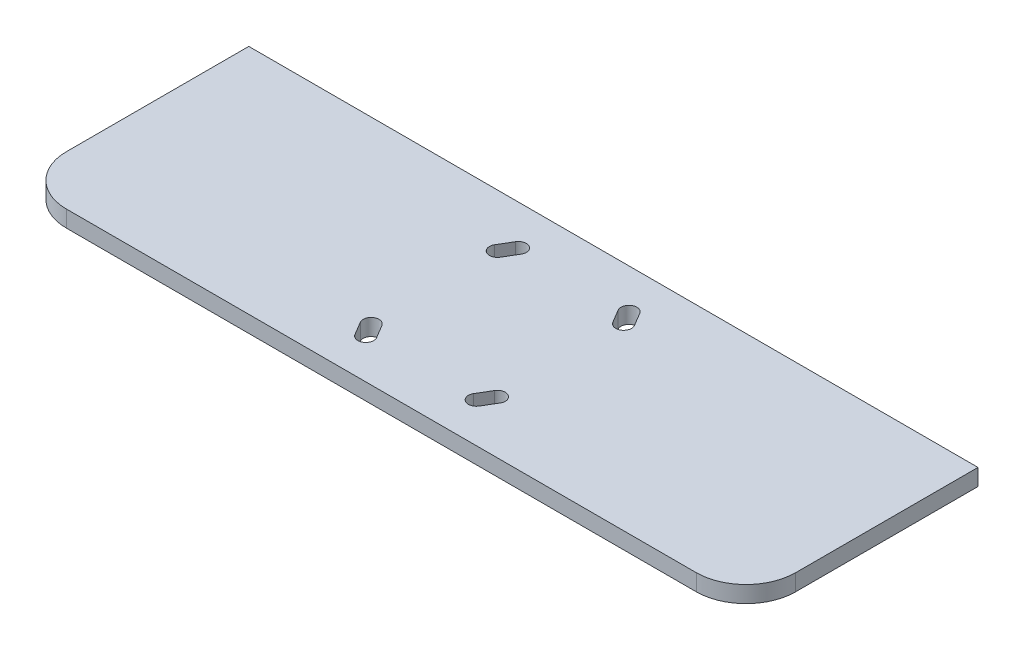
from build123d import *

# Parameters (mm, degrees)
BOSS_EXTRUDE1_DEPTH = 10
CUT_EXTRUDE2_DEPTH  = 232.084400166


with BuildPart() as part:
    # Sketch1 → Boss-Extrude1 (new body)
    with BuildSketch(Plane(origin=(0, 0, 0), x_dir=(1, 0, 0), z_dir=(0, 1, 0))):
        with BuildLine():
            Line((-190, -70), (190, -70))
            ThreePointArc((190, -70), (211.213203436, -61.213203436), (220, -40))
            Line((220, -40), (220, 70))
            Line((220, 70), (-220, 70))
            Line((-220, 70), (-220, -40))
            ThreePointArc((-220, -40), (-211.213203436, -61.213203436), (-190, -70))
        make_face()
    extrude(amount=BOSS_EXTRUDE1_DEPTH)

    # Sketch3 → Cut-Extrude2 (cut, through all)
    with BuildSketch(Plane(origin=(0, 10, 0), x_dir=(1, 0, 0), z_dir=(0, 1, 0))):
        with BuildLine():
            Line((-2466.524123707, -5837.229065469), (-2474.461623707, -5841.991565469))
            ThreePointArc((-2474.461623707, -5841.991565469), (-2480.995719801, -5840.358041446), (-2479.362195777, -5833.823945352))
            Line((-2479.362195777, -5833.823945352), (-2471.424695777, -5829.061445352))
            ThreePointArc((-2471.424695777, -5829.061445352), (-2464.890599684, -5830.694969376), (-2466.524123707, -5837.229065469))
        make_face()
        with BuildLine():
            Line((-2466.524123707, -5905.261445352), (-2474.461623707, -5900.498945352))
            ThreePointArc((-2474.461623707, -5900.498945352), (-2480.995719801, -5902.132469376), (-2479.362195777, -5908.666565469))
            Line((-2479.362195777, -5908.666565469), (-2471.424695777, -5913.429065469))
            ThreePointArc((-2471.424695777, -5913.429065469), (-2464.890599684, -5911.795541446), (-2466.524123707, -5905.261445352))
        make_face()
        with BuildLine():
            Line((-2395.224695777, -5837.229065469), (-2387.287195777, -5841.991565469))
            ThreePointArc((-2387.287195777, -5841.991565469), (-2380.753099684, -5840.358041446), (-2382.386623707, -5833.823945352))
            Line((-2382.386623707, -5833.823945352), (-2390.324123707, -5829.061445352))
            ThreePointArc((-2390.324123707, -5829.061445352), (-2396.858219801, -5830.694969376), (-2395.224695777, -5837.229065469))
        make_face()
        with BuildLine():
            Line((-2395.224695777, -5905.261445352), (-2387.287195777, -5900.498945352))
            ThreePointArc((-2387.287195777, -5900.498945352), (-2380.753099684, -5902.132469376), (-2382.386623707, -5908.666565469))
            Line((-2382.386623707, -5908.666565469), (-2390.324123707, -5913.429065469))
            ThreePointArc((-2390.324123707, -5913.429065469), (-2396.858219801, -5911.795541446), (-2395.224695777, -5905.261445352))
        make_face()
        with BuildLine():
            Line((-34.016189941, -35.649713965), (-29.253689941, -43.587213965))
            ThreePointArc((-29.253689941, -43.587213965), (-30.887213965, -50.121310059), (-37.421310059, -48.487786035))
            Line((-37.421310059, -48.487786035), (-42.183810059, -40.550286035))
            ThreePointArc((-42.183810059, -40.550286035), (-40.550286035, -34.016189941), (-34.016189941, -35.649713965))
        make_face()
        with BuildLine():
            Line((34.016189941, -35.649713965), (29.253689941, -43.587213965))
            ThreePointArc((29.253689941, -43.587213965), (30.887213965, -50.121310059), (37.421310059, -48.487786035))
            Line((37.421310059, -48.487786035), (42.183810059, -40.550286035))
            ThreePointArc((42.183810059, -40.550286035), (40.550286035, -34.016189941), (34.016189941, -35.649713965))
        make_face()
        with BuildLine():
            Line((-34.016189941, 35.649713965), (-29.253689941, 43.587213965))
            ThreePointArc((-29.253689941, 43.587213965), (-30.887213965, 50.121310059), (-37.421310059, 48.487786035))
            Line((-37.421310059, 48.487786035), (-42.183810059, 40.550286035))
            ThreePointArc((-42.183810059, 40.550286035), (-40.550286035, 34.016189941), (-34.016189941, 35.649713965))
        make_face()
        with BuildLine():
            Line((34.016189941, 35.649713965), (29.253689941, 43.587213965))
            ThreePointArc((29.253689941, 43.587213965), (30.887213965, 50.121310059), (37.421310059, 48.487786035))
            Line((37.421310059, 48.487786035), (42.183810059, 40.550286035))
            ThreePointArc((42.183810059, 40.550286035), (40.550286035, 34.016189941), (34.016189941, 35.649713965))
        make_face()
    extrude(amount=-CUT_EXTRUDE2_DEPTH, mode=Mode.SUBTRACT)


solid = part.part
